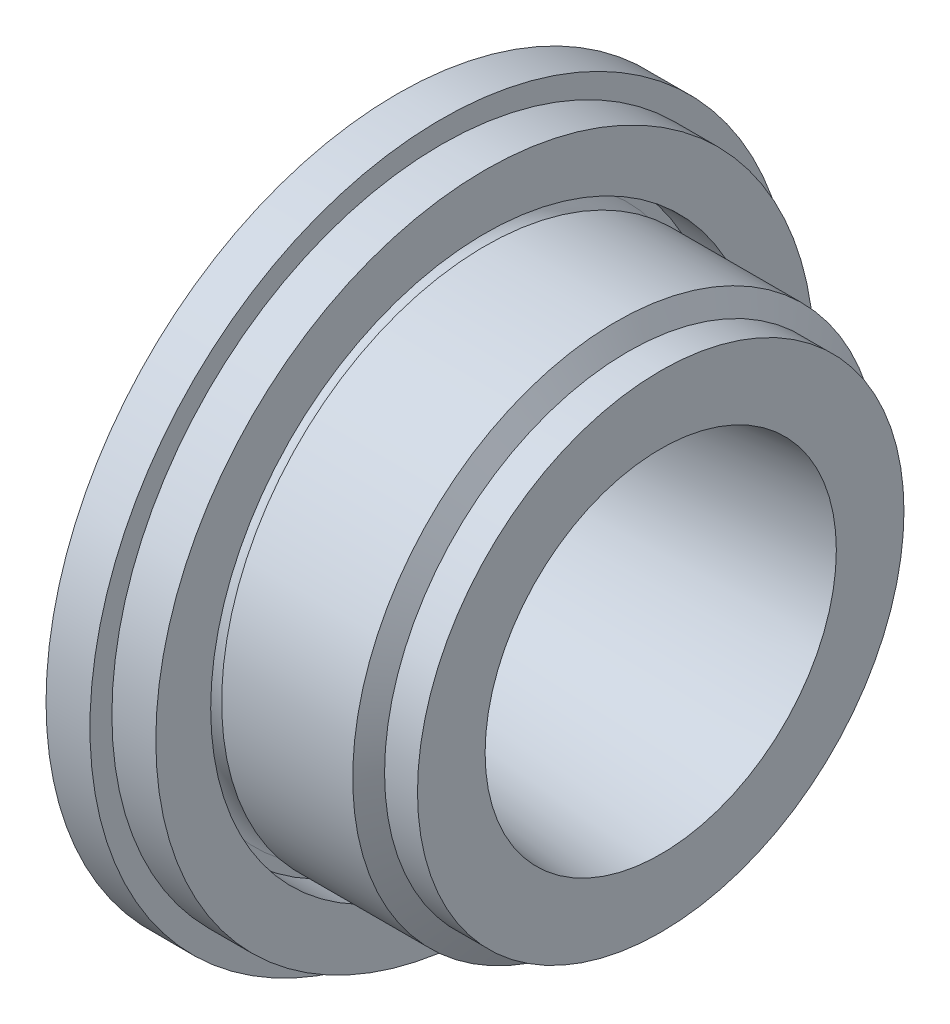
from build123d import *

# Parameters (mm, degrees)
ZAOBLIT1_R                    = 0.2
SKICA3_W                      = 2
SKICA3_H                      = 2.5
ODEBRAT_VYSUNUT_M1_REACH      = 27.612
ODEBRAT_VYSUNUT_M1_END_RADIUS = 34
SKICA4_R                      = 1.5
KRUHOV_START                  = 1.212807508
KRUHOV_POLE1_OUTLINE_R        = 1.5
KRUHOV_POLE1_DEPTH            = 2.787192492


# Read off the part's stored shape, not the designer's step: Kruhové pole1
with BuildPart() as part:
    # Skica1 → Otočit kolem osy1 (revolve)
    with BuildSketch(Plane.XY, mode=Mode.PRIVATE) as oto_it_kolem_osy1_sk:
        with BuildLine():
            Line((0, 0), (16, 0))
            Line((16, 0), (16, 11.08))
            Line((16, 11.08), (14.5, 11.08))
            Line((14.5, 11.08), (13.968837752, 12))
            Line((13.968837752, 12), (8, 12))
            ThreePointArc((8, 12), (7, 11), (6, 12))
            Line((6, 12), (6, 16))
            Line((6, 16), (4, 16))
            ThreePointArc((4, 16), (1.015154995, 8.246211251), (0, 0))
        make_face()
    revolve(oto_it_kolem_osy1_sk.sketch.rotate(Axis((0, 0, 0), (-1, 0, 0)), 90), axis=Axis((0, 0, 0), (-1, 0, 0)))

    # Skica2 → Odebrat otočením2 (revolve, cut)
    with BuildSketch(Plane(origin=(0, 0, 0), x_dir=(1, 0, 0), z_dir=(0, 1, 0)), mode=Mode.PRIVATE) as odebrat_oto_en_m2_sk:
        with BuildLine():
            Line((16, 8), (2.976010641, 6.860548577))
            Line((2.976010641, 6.860548577), (5.671087358, 5.342341773))
            Line((5.671087358, 5.342341773), (2.593122123, 5.034900037))
            Line((2.593122123, 5.034900037), (5.288198839, 3.516693233))
            Line((5.288198839, 3.516693233), (2.210233604, 3.209251497))
            Line((2.210233604, 3.209251497), (5.103899722, 2.116051237))
            Line((5.103899722, 2.116051237), (2.052614667, 1.60806509))
            ThreePointArc((2.052614667, 1.60806509), (2.013157185, 0.804462808), (2, 0))
            Line((2, 0), (16, 0))
            Line((16, 0), (16, 8))
        make_face()
    revolve(odebrat_oto_en_m2_sk.sketch.rotate(Axis((0, 0, 0), (1, 0, 0)), 180), axis=Axis((0, 0, 0), (1, 0, 0)), mode=Mode.SUBTRACT)

    # Zaoblit1
    zaoblit1_edges = [part.edges().sort_by_distance(p)[0] for p in [
        (2.976010641, 0, -6.860548577),
        (5.671087358, 0, -5.342341773),
        (2.593122123, 0, -5.034900037),
        (5.288198839, 0, -3.516693233),
        (2.210233604, 0, -3.209251497),
        (5.103899722, 0, -2.116051237),
        (2.052614667, 0, -1.60806509),
    ]]
    fillet(zaoblit1_edges, radius=ZAOBLIT1_R)

    # Odebrat vysunutím1: up to this sphere (the profile starts inside it)
    odebrat_vysunut_m1_end = Location((34, 0, 0)) * Sphere(ODEBRAT_VYSUNUT_M1_END_RADIUS, mode=Mode.PRIVATE)
    # Skica4 → Odebrat vysunutím1 (cut, up to the surface)
    with BuildSketch(Plane(origin=(4, 0, 0), x_dir=(0, 0, -1), z_dir=(1, 0, 0)), mode=Mode.PRIVATE) as odebrat_vysunut_m1_sk1:
        with Locations((0, 10.5)):
            Circle(SKICA4_R)
    odebrat_vysunut_m1_tool1 = extrude(odebrat_vysunut_m1_sk1.sketch, amount=-ODEBRAT_VYSUNUT_M1_REACH, mode=Mode.PRIVATE) & odebrat_vysunut_m1_end
    add(odebrat_vysunut_m1_tool1.solids().sort_by_distance((4, 10.5, 0))[0], mode=Mode.SUBTRACT)

    # Kruhové pole1 outline → Kruhové pole1 (cut)
    with BuildSketch(Plane.YZ.offset(KRUHOV_START)):
        with Locations((-10.5, 0)):
            Circle(KRUHOV_POLE1_OUTLINE_R)
    extrude(amount=KRUHOV_POLE1_DEPTH, mode=Mode.SUBTRACT)


with BuildPart() as body_2:
    # Skica3 → Otočit kolem osy2 (revolve)
    with BuildSketch(Plane(origin=(0, 0, 0), x_dir=(1, 0, 0), z_dir=(0, 1, 0))):
        with Locations((7, 13.75)):
            Rectangle(SKICA3_W, SKICA3_H)
    revolve(axis=Axis((0, 0, 0), (1, 0, 0)))


solid = Compound([part.part, body_2.part])
